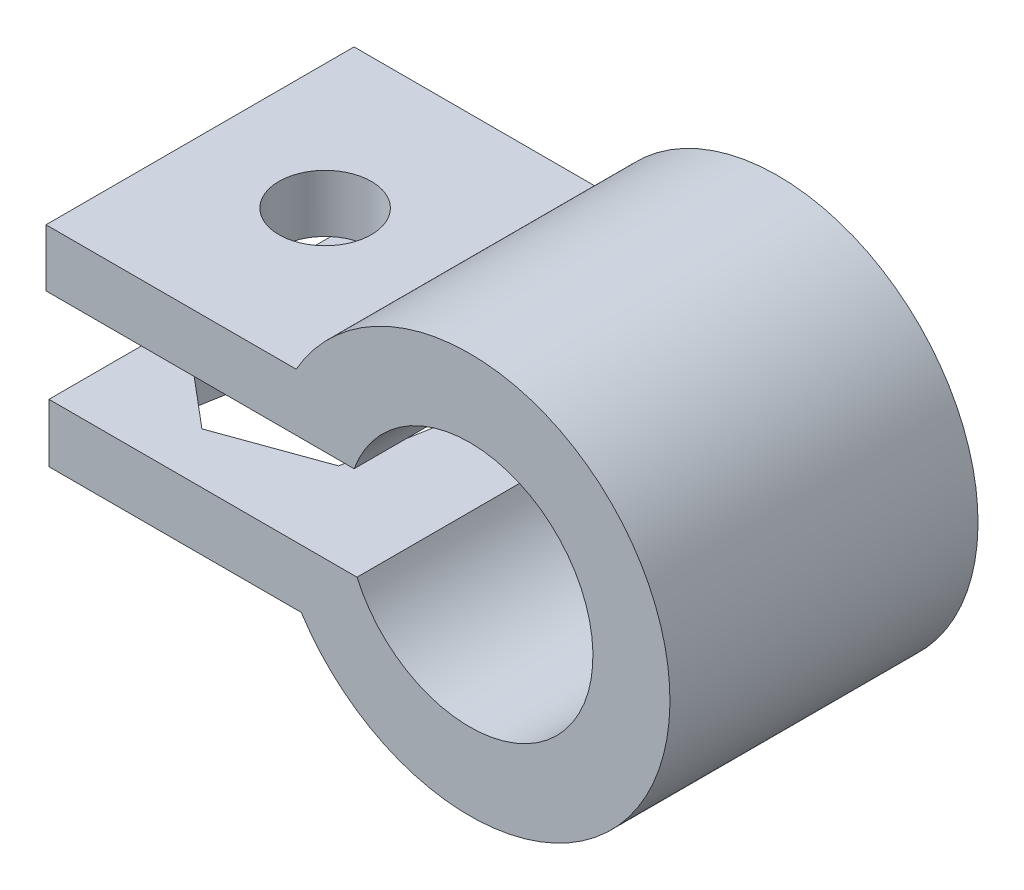
from build123d import *

# Parameters (mm, degrees)
SKETCH1_R           = 6.5
SKETCH1_R_2         = 4
BOSS_EXTRUDE1_DEPTH = 10
SKETCH2_W           = 3.218226301
SKETCH2_H           = 3
CUT_EXTRUDE1_DEPTH  = 33
SKETCH3_W           = 10
SKETCH3_H           = 1.895177711
SKETCH3_H_2         = 1.85941964
BOSS_EXTRUDE2_DEPTH = 10
SKETCH4_R           = 1.5
CUT_EXTRUDE2_DEPTH  = 40
CUT_EXTRUDE3_DEPTH  = 3


with BuildPart() as part:
    # Sketch1 → Boss-Extrude1 (new body)
    with BuildSketch(Plane.XY):
        with Locations((-12.315422017, 2.550703256)):
            Circle(SKETCH1_R)
        with Locations((-12.315422017, 2.550703256)):
            Circle(SKETCH1_R_2, mode=Mode.SUBTRACT)
    extrude(amount=BOSS_EXTRUDE1_DEPTH)

    # Sketch2 → Cut-Extrude1 (cut)
    with BuildSketch(Plane.XY.offset(10)):
        with Locations((-17.357309889, 2.432650589)):
            Rectangle(SKETCH2_W, SKETCH2_H)
    extrude(amount=-CUT_EXTRUDE1_DEPTH, mode=Mode.SUBTRACT)

    # Sketch3 → Boss-Extrude2 (add)
    with BuildSketch(Plane.XY.offset(10)):
        with Locations((-20.973550714, -0.014938266)):
            Rectangle(SKETCH3_W, SKETCH3_H)
        with Locations((-21.069116407, 4.862360409)):
            Rectangle(SKETCH3_W, SKETCH3_H_2)
    extrude(amount=-BOSS_EXTRUDE2_DEPTH)

    # Sketch4 → Cut-Extrude2 (cut)
    with BuildSketch(Plane(origin=(0, 5.792070229, 0), x_dir=(1, 0, 0), z_dir=(0, 1, 0))):
        with Locations((-22.009116407, -5)):
            Circle(SKETCH4_R)
    extrude(amount=-CUT_EXTRUDE2_DEPTH, mode=Mode.SUBTRACT)

    # Sketch5 → Cut-Extrude3 (cut)
    with BuildSketch(Plane(origin=(0, -0.962527122, 0), x_dir=(-1, 0, 0), z_dir=(0, -1, 0))):
        Polygon((19.402957018, -7.170600246), (22.661040937, -8.347413391), (25.309232976, -6.114236523), (24.699341096, -2.704246509), (21.441257177, -1.527433364), (18.793065138, -3.760610232), align=None)
    extrude(amount=-CUT_EXTRUDE3_DEPTH, mode=Mode.SUBTRACT)


solid = part.part
